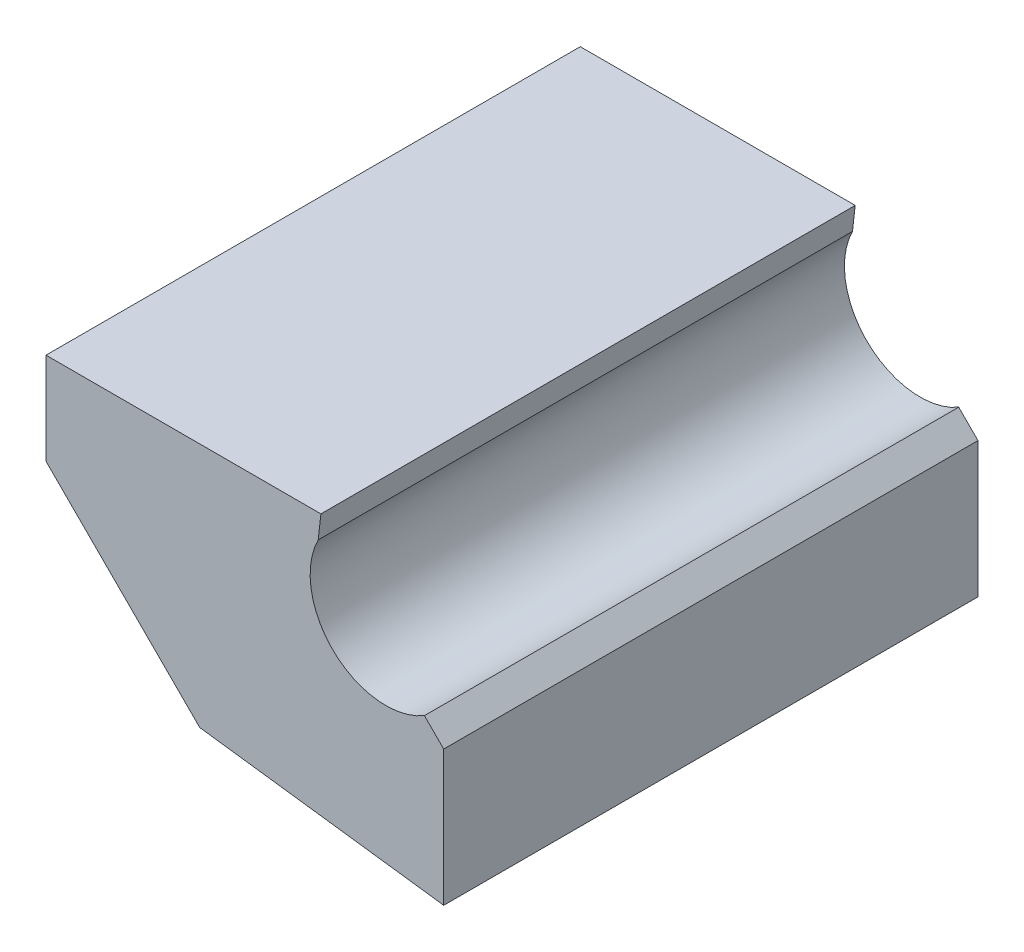
from build123d import *

# Parameters (mm, degrees)
BOSS_EXTRU_1_DEPTH = 60
CHANFREIN1_START   = -1
CHANFREIN1_DEPTH   = 62
CHANFREIN2_SIZE    = 15
CHANFREIN2_SIZE2   = 17.409920551


with BuildPart() as part:
    # Esquisse1 → Boss.-Extru.1 (new body)
    with BuildSketch(Plane.XY):
        with BuildLine():
            Line((-1.739730228, 1.739730228), (-46.4022226, 7.592964471))
            Line((-46.4022226, 7.592964471), (-46.4022226, 32.915406071))
            Line((-46.4022226, 32.915406071), (-13.716955803, 32.915406071))
            ThreePointArc((-13.716955803, 32.915406071), (-14.250137868, 20.404998431), (-1.739730228, 20.938180496))
            Line((-1.739730228, 20.938180496), (-1.739730228, 1.739730228))
        make_face()
    extrude(amount=BOSS_EXTRU_1_DEPTH)

    # Chanfrein1: read off the stored shape, not the designer's step
    # Chanfrein1 outline → Chanfrein1 (cut)
    with BuildSketch(Plane.XY.offset(CHANFREIN1_START)):
        with BuildLine():
            ThreePointArc((-1.739730228, 20.938180496), (-2.7453552, 19.929895832), (-3.905196789, 19.103647058))
            Line((-3.905196789, 19.103647058), (-1.739730228, 16.938180496))
            Line((-1.739730228, 16.938180496), (-1.739730228, 20.938180496))
        make_face()
        with BuildLine():
            Line((-15.530475388, 32.915406071), (-15.835720777, 30.229973881))
            ThreePointArc((-15.835720777, 30.229973881), (-14.912820327, 31.680372218), (-13.716955803, 32.915406071))
            Line((-13.716955803, 32.915406071), (-15.530475388, 32.915406071))
        make_face()
    extrude(amount=CHANFREIN1_DEPTH, mode=Mode.SUBTRACT)

    # Chanfrein2
    chanfrein2_edges = [part.edges().sort_by_distance(p)[0] for p in [
        (-46.4022226, 7.592964471, 30),
    ]]
    chanfrein2_side = [part.faces().sort_by_distance(p)[0] for p in [
        (-46.4022226, 20.254185271, 30),
    ]]
    chamfer(chanfrein2_edges, length=CHANFREIN2_SIZE, length2=CHANFREIN2_SIZE2, reference=chanfrein2_side[0])


solid = part.part
